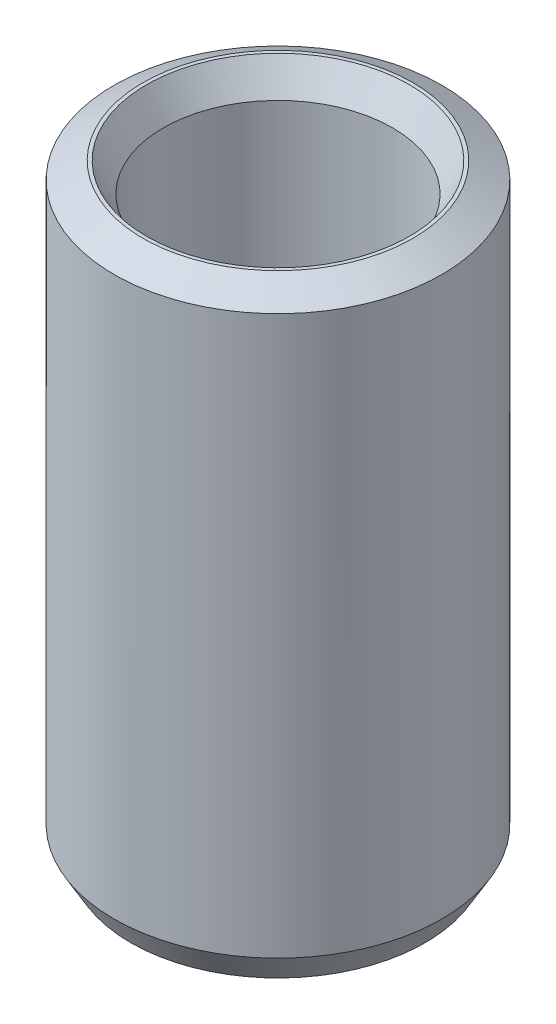
from build123d import *
from OCP.BRepFilletAPI import BRepFilletAPI_MakeChamfer

# Parameters (mm, degrees)
SKETCH1_R           = 30
BOSS_EXTRUDE1_DEPTH = 110.504376162
SKETCH2_R           = 20.98068545
CUT_EXTRUDE1_DEPTH  = 119.368987285
CHAMFER1_SIZE       = 3.066088143
CHAMFER1_SIZE2      = 5.310620444


with BuildPart() as part:
    # Sketch1 → Boss-Extrude1 (new body)
    with BuildSketch(Plane(origin=(0, 0, 0), x_dir=(1, 0, 0), z_dir=(0, 1, 0))):
        Circle(SKETCH1_R)
    extrude(amount=BOSS_EXTRUDE1_DEPTH)

    # Sketch2 → Cut-Extrude1 (cut, through all)
    with BuildSketch(Plane(origin=(0, 0, 0), x_dir=(1, 0, 0), z_dir=(0, 1, 0))):
        Circle(SKETCH2_R)
    extrude(amount=CUT_EXTRUDE1_DEPTH, mode=Mode.SUBTRACT)

    # Chamfer1: one chamfer whose edges measure the first distance from different faces: ONE call of the kernel's chamfer builder (chamfer() names one face for all edges)
    chamfer1_edges_1 = [part.edges().sort_by_distance(p)[0] for p in [
        (-20.98068545, 110.504376162, 0),
    ]]
    chamfer1_side_1 = [part.faces().sort_by_distance(p)[0] for p in [
        (-29.151471863, 110.504376162, 0),
    ]]
    chamfer1_edges_2 = [part.edges().sort_by_distance(p)[0] for p in [
        (-20.98068545, 0, 0),
    ]]
    chamfer1_side_2 = [part.faces().sort_by_distance(p)[0] for p in [
        (-20.98068545, 55.252188081, 0),
    ]]
    chamfer1_edges_3 = [part.edges().sort_by_distance(p)[0] for p in [
        (-30, 0, 0),
    ]]
    chamfer1_side_3 = [part.faces().sort_by_distance(p)[0] for p in [
        (-29.151471863, 0, 0),
    ]]
    chamfer1_edges_4 = [part.edges().sort_by_distance(p)[0] for p in [
        (-30, 110.504376162, 0),
    ]]
    chamfer1_side_4 = [part.faces().sort_by_distance(p)[0] for p in [
        (-30, 55.252188081, 0),
    ]]
    chamfer1 = BRepFilletAPI_MakeChamfer(part.part.solid().wrapped)
    for e in chamfer1_edges_1:
        chamfer1.Add(CHAMFER1_SIZE, CHAMFER1_SIZE2, e.wrapped, chamfer1_side_1[0].wrapped)  # the first distance lies on this face
    for e in chamfer1_edges_2:
        chamfer1.Add(CHAMFER1_SIZE, CHAMFER1_SIZE2, e.wrapped, chamfer1_side_2[0].wrapped)  # the first distance lies on this face
    for e in chamfer1_edges_3:
        chamfer1.Add(CHAMFER1_SIZE, CHAMFER1_SIZE2, e.wrapped, chamfer1_side_3[0].wrapped)  # the first distance lies on this face
    for e in chamfer1_edges_4:
        chamfer1.Add(CHAMFER1_SIZE, CHAMFER1_SIZE2, e.wrapped, chamfer1_side_4[0].wrapped)  # the first distance lies on this face
    add(Compound.cast(chamfer1.Shape()), mode=Mode.REPLACE)


solid = part.part
